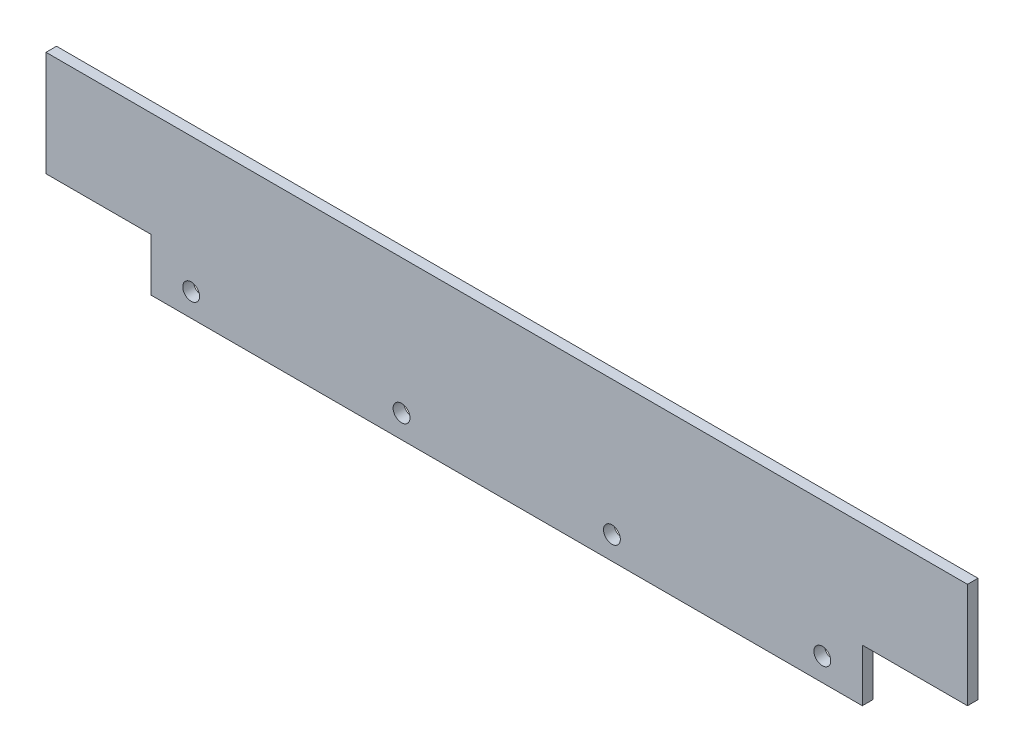
from build123d import *

# Parameters (mm, degrees)
CROQUIS1_R              = 4
SALIENTE_EXTRUIR1_DEPTH = 5


with BuildPart() as part:
    # Croquis1 → Saliente-Extruir1 (new body)
    with BuildSketch(Plane.XY):
        Polygon((0, 0), (-338, 0), (-338, 25), (-388, 25), (-388, 75), (50, 75), (50, 25), (0, 25), align=None)
        with Locations((-319, 11)):
            Circle(CROQUIS1_R, mode=Mode.SUBTRACT)
        with Locations((-219, 11)):
            Circle(CROQUIS1_R, mode=Mode.SUBTRACT)
        with Locations((-119, 11)):
            Circle(CROQUIS1_R, mode=Mode.SUBTRACT)
        with Locations((-19, 11)):
            Circle(CROQUIS1_R, mode=Mode.SUBTRACT)
    extrude(amount=SALIENTE_EXTRUIR1_DEPTH)


solid = part.part
